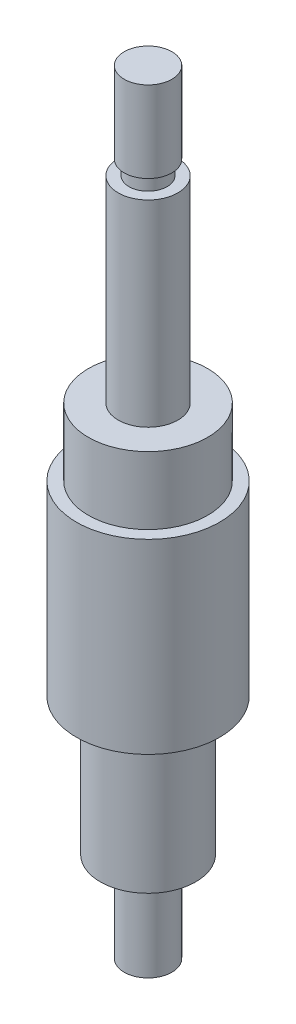
from build123d import *


with BuildPart() as part:
    # Sketch1 → Revolve1 (revolve)
    with BuildSketch(Plane.XY):
        Polygon((0, 0), (2, 0), (2, 7.56117322), (4, 7.56117322), (4, 19.054924212), (6, 19.054924212), (6, 34.6718055), (5, 34.6718055), (5, 40.333660498), (2.5, 40.333660498), (2.5, 56.833660498), (1.6, 56.833660498), (1.6, 58.033660498), (2, 58.033660498), (2, 64.833660498), (0, 64.833660498), align=None)
    revolve(axis=Axis((0, 0, 0), (0, 1, 0)))


solid = part.part
